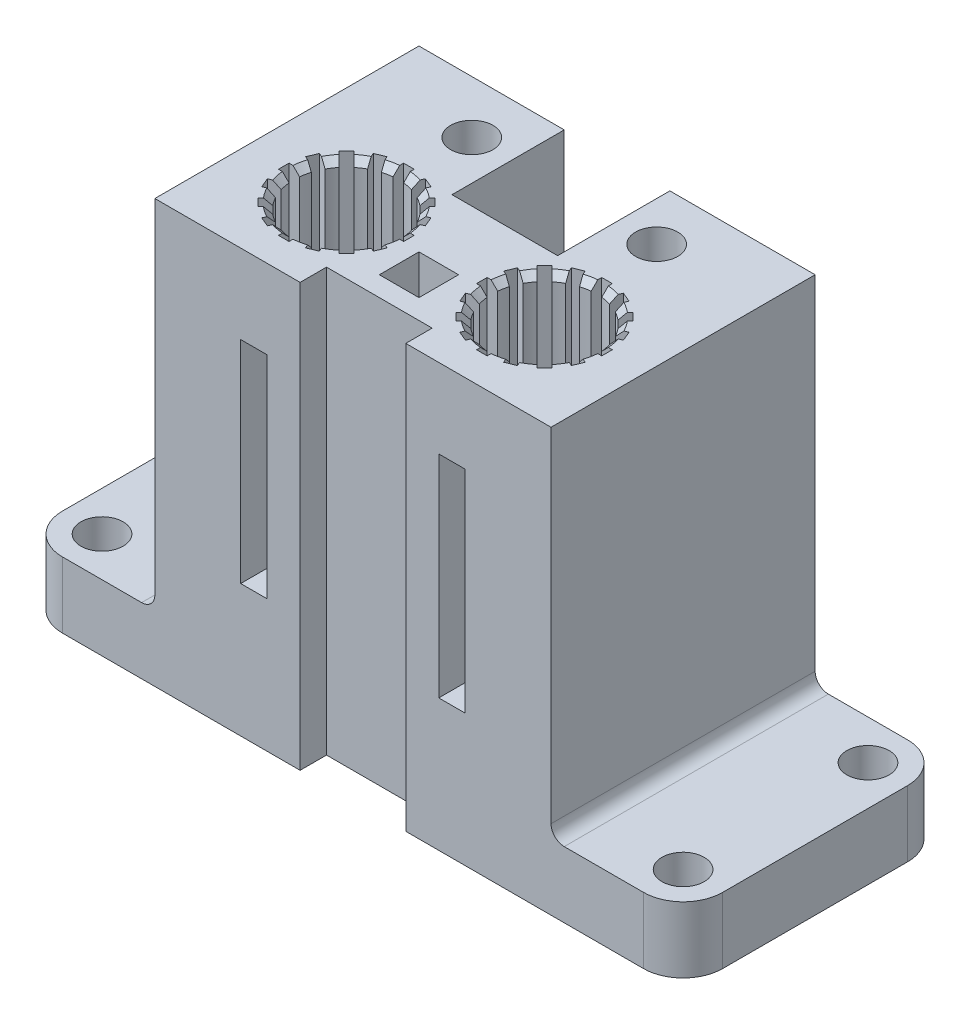
from build123d import *

# Parameters (mm, degrees)
SKETCH_1_W                = 30
SKETCH_1_H                = 20
EXTRUDE_1_DEPTH           = 32
SKETCH_2_R                = 3.96
CUT_EXTRUDE_1_DEPTH       = 8
CUT_EXTRUDE_START         = -12
SKETCH_3_R                = 3.96
CUT_EXTRUDE_2_DEPTH       = 12
SKETCH_4_W                = 8
SKETCH_4_H                = 8.5
CUT_EXTRUDE_3_DEPTH       = 25
SKETCH_6_R                = 2.25
CUT_EXTRUDE_5_DEPTH       = 31.01666204
SKETCH_5_W                = 2
SKETCH_5_H                = 16
CUT_EXTRUDE_4_DEPTH       = 41.607881008
SKETCH_7_W                = 8
SKETCH_7_H                = 2
CUT_EXTRUDE_6_DEPTH       = 37.728735344
SKETCH_8_R                = 1.6
CUT_EXTRUDE_7_DEPTH       = 6
SKETCH_10_R               = 1.6
CUT_EXTRUDE_8_DEPTH       = 6
CHAMFER_1_SIZE            = 0.5
SKETCH_11_W               = 0.8
SKETCH_11_H               = 0.8
CUT_EXTRUDE_9_DEPTH       = 8
PATTERN_CIRCULAR_1_COUNT  = 16
SKETCH_12_W               = 0.8
SKETCH_12_H               = 0.8
CUT_EXTRUDE_10_DEPTH      = 12
PATTERN_CIRCULAR_2_COUNT  = 16
MIRROR_1_COPY_1_SKETCH_W  = 0.8
MIRROR_1_COPY_1_SKETCH_H  = 0.8
MIRROR_1_COPY_1_DEPTH     = 8
MIRROR_1_COPY_2_SKETCH_W  = 0.8
MIRROR_1_COPY_2_SKETCH_H  = 0.8
MIRROR_1_COPY_2_DEPTH     = 8
MIRROR_1_COPY_3_SKETCH_W  = 0.8
MIRROR_1_COPY_3_SKETCH_H  = 0.8
MIRROR_1_COPY_3_DEPTH     = 8
MIRROR_1_COPY_4_SKETCH_W  = 0.8
MIRROR_1_COPY_4_SKETCH_H  = 0.8
MIRROR_1_COPY_4_DEPTH     = 8
MIRROR_1_COPY_5_SKETCH_W  = 0.8
MIRROR_1_COPY_5_SKETCH_H  = 0.8
MIRROR_1_COPY_5_DEPTH     = 8
MIRROR_1_COPY_6_SKETCH_W  = 0.8
MIRROR_1_COPY_6_SKETCH_H  = 0.8
MIRROR_1_COPY_6_DEPTH     = 8
MIRROR_1_COPY_7_SKETCH_W  = 0.8
MIRROR_1_COPY_7_SKETCH_H  = 0.8
MIRROR_1_COPY_7_DEPTH     = 8
MIRROR_1_COPY_8_SKETCH_W  = 0.8
MIRROR_1_COPY_8_SKETCH_H  = 0.8
MIRROR_1_COPY_8_DEPTH     = 8
MIRROR_1_COPY_9_SKETCH_W  = 0.8
MIRROR_1_COPY_9_SKETCH_H  = 0.8
MIRROR_1_COPY_9_DEPTH     = 8
MIRROR_1_COPY_10_SKETCH_W = 0.8
MIRROR_1_COPY_10_SKETCH_H = 0.8
MIRROR_1_COPY_10_DEPTH    = 8
MIRROR_1_COPY_11_SKETCH_W = 0.8
MIRROR_1_COPY_11_SKETCH_H = 0.8
MIRROR_1_COPY_11_DEPTH    = 8
MIRROR_1_COPY_12_SKETCH_W = 0.8
MIRROR_1_COPY_12_SKETCH_H = 0.8
MIRROR_1_COPY_12_DEPTH    = 8
MIRROR_1_COPY_13_SKETCH_W = 0.8
MIRROR_1_COPY_13_SKETCH_H = 0.8
MIRROR_1_COPY_13_DEPTH    = 8
MIRROR_1_COPY_14_SKETCH_W = 0.8
MIRROR_1_COPY_14_SKETCH_H = 0.8
MIRROR_1_COPY_14_DEPTH    = 8
MIRROR_1_COPY_15_SKETCH_W = 0.8
MIRROR_1_COPY_15_SKETCH_H = 0.8
MIRROR_1_COPY_15_DEPTH    = 8
MIRROR_1_COPY_16_SKETCH_W = 0.8
MIRROR_1_COPY_16_SKETCH_H = 0.8
MIRROR_1_COPY_16_DEPTH    = 12
MIRROR_1_COPY_17_SKETCH_W = 0.8
MIRROR_1_COPY_17_SKETCH_H = 0.8
MIRROR_1_COPY_17_DEPTH    = 12
MIRROR_1_COPY_18_SKETCH_W = 0.8
MIRROR_1_COPY_18_SKETCH_H = 0.8
MIRROR_1_COPY_18_DEPTH    = 12
MIRROR_1_COPY_19_SKETCH_W = 0.8
MIRROR_1_COPY_19_SKETCH_H = 0.8
MIRROR_1_COPY_19_DEPTH    = 12
MIRROR_1_COPY_20_SKETCH_W = 0.8
MIRROR_1_COPY_20_SKETCH_H = 0.8
MIRROR_1_COPY_20_DEPTH    = 12
MIRROR_1_COPY_21_SKETCH_W = 0.8
MIRROR_1_COPY_21_SKETCH_H = 0.8
MIRROR_1_COPY_21_DEPTH    = 12
MIRROR_1_COPY_22_SKETCH_W = 0.8
MIRROR_1_COPY_22_SKETCH_H = 0.8
MIRROR_1_COPY_22_DEPTH    = 12
MIRROR_1_COPY_23_SKETCH_W = 0.8
MIRROR_1_COPY_23_SKETCH_H = 0.8
MIRROR_1_COPY_23_DEPTH    = 12
MIRROR_1_COPY_24_SKETCH_W = 0.8
MIRROR_1_COPY_24_SKETCH_H = 0.8
MIRROR_1_COPY_24_DEPTH    = 12
MIRROR_1_COPY_25_SKETCH_W = 0.8
MIRROR_1_COPY_25_SKETCH_H = 0.8
MIRROR_1_COPY_25_DEPTH    = 12
MIRROR_1_COPY_26_SKETCH_W = 0.8
MIRROR_1_COPY_26_SKETCH_H = 0.8
MIRROR_1_COPY_26_DEPTH    = 12
MIRROR_1_COPY_27_SKETCH_W = 0.8
MIRROR_1_COPY_27_SKETCH_H = 0.8
MIRROR_1_COPY_27_DEPTH    = 12
MIRROR_1_COPY_28_SKETCH_W = 0.8
MIRROR_1_COPY_28_SKETCH_H = 0.8
MIRROR_1_COPY_28_DEPTH    = 12
MIRROR_1_COPY_29_SKETCH_W = 0.8
MIRROR_1_COPY_29_SKETCH_H = 0.8
MIRROR_1_COPY_29_DEPTH    = 12
MIRROR_1_COPY_30_SKETCH_W = 0.8
MIRROR_1_COPY_30_SKETCH_H = 0.8
MIRROR_1_COPY_30_DEPTH    = 12
SKETCH_13_W               = 3
SKETCH_13_H               = 3
CUT_EXTRUDE_11_DEPTH      = 4
SKETCH_14_W               = 10
SKETCH_14_H               = 20
EXTRUDE_3_DEPTH           = 5
SKETCH_15_R               = 1.6
CUT_EXTRUDE_12_DEPTH      = 39.13135193
FILLET_1_R                = 1
FILLET_2_R                = 3


with BuildPart() as part:
    # 草图1 → 凸台-拉伸1 (new body)
    with BuildSketch(Plane(origin=(0, 0, 0), x_dir=(1, 0, 0), z_dir=(0, 1, 0))):
        Rectangle(SKETCH_1_W, SKETCH_1_H)
    extrude(amount=EXTRUDE_1_DEPTH)

    # 草图2 → 切除-拉伸1 (cut)
    with BuildSketch(Plane(origin=(0, 32, 0), x_dir=(1, 0, 0), z_dir=(0, 1, 0))):
        with Locations(Location((-7.5, -3, 0), (0, 0, 270))):
            Circle(SKETCH_2_R)
        with Locations(Location((7.5, -3, 0), (0, 0, 270))):
            Circle(SKETCH_2_R)
    extrude(amount=-CUT_EXTRUDE_1_DEPTH, mode=Mode.SUBTRACT)

    # 草图3 → 切除-拉伸2 (cut)
    with BuildSketch(Plane(origin=(0, 24, 0), x_dir=(1, 0, 0), z_dir=(0, 1, 0)).offset(CUT_EXTRUDE_START)):
        with Locations(Location((-7.5, -3, 0), (0, 0, 270))):
            Circle(SKETCH_3_R)
        with Locations(Location((7.5, -3, 0), (0, 0, 270))):
            Circle(SKETCH_3_R)
    extrude(amount=-CUT_EXTRUDE_2_DEPTH, mode=Mode.SUBTRACT)

    # 草图4 → 切除-拉伸3 (cut)
    with BuildSketch(Plane(origin=(0, 32, 0), x_dir=(1, 0, 0), z_dir=(0, 1, 0))):
        with Locations((0, 5.75)):
            Rectangle(SKETCH_4_W, SKETCH_4_H)
    extrude(amount=-CUT_EXTRUDE_3_DEPTH, mode=Mode.SUBTRACT)

    # 草图6 → 切除-拉伸5 (cut, through all)
    with BuildSketch(Plane(origin=(0, 24, 0), x_dir=(1, 0, 0), z_dir=(0, 1, 0))):
        with Locations(Location((7.5, -3, 0), (0, 0, 270))):
            Circle(SKETCH_6_R)
        with Locations(Location((-7.5, -3, 0), (0, 0, 270))):
            Circle(SKETCH_6_R)
    extrude(amount=-CUT_EXTRUDE_5_DEPTH, mode=Mode.SUBTRACT)

    # 草图5 → 切除-拉伸4 (cut, through all)
    with BuildSketch(Plane(origin=(0, 0, -10), x_dir=(-1, 0, 0), z_dir=(0, 0, -1))):
        with Locations((7.5, 18)):
            Rectangle(SKETCH_5_W, SKETCH_5_H)
        with Locations((-7.5, 18)):
            Rectangle(SKETCH_5_W, SKETCH_5_H)
    extrude(amount=-CUT_EXTRUDE_4_DEPTH, mode=Mode.SUBTRACT)

    # 草图7 → 切除-拉伸6 (cut, through all)
    with BuildSketch(Plane(origin=(0, 32, 0), x_dir=(1, 0, 0), z_dir=(0, 1, 0))):
        with Locations((0, -9)):
            Rectangle(SKETCH_7_W, SKETCH_7_H)
    extrude(amount=-CUT_EXTRUDE_6_DEPTH, mode=Mode.SUBTRACT)

    # 草图8 → 切除-拉伸7 (cut)
    with BuildSketch(Plane(origin=(0, 0, -10), x_dir=(-1, 0, 0), z_dir=(0, 0, -1))):
        with Locations((-12, 29)):
            Circle(SKETCH_8_R)
        with Locations(Location((12, 29, 0), (0, 0, 180))):
            Circle(SKETCH_8_R)
        with Locations(Location((-12, 3, 0), (0, 0, 180))):
            Circle(SKETCH_8_R)
        with Locations((12, 3)):
            Circle(SKETCH_8_R)
    extrude(amount=-CUT_EXTRUDE_7_DEPTH, mode=Mode.SUBTRACT)

    # 草图10 → 切除-拉伸8 (cut)
    with BuildSketch(Plane(origin=(0, 32, 0), x_dir=(1, 0, 0), z_dir=(0, 1, 0))):
        with Locations(Location((7, 6, 0), (0, 0, 270))):
            Circle(SKETCH_10_R)
        with Locations(Location((-7, 6, 0), (0, 0, 288.209956864))):
            Circle(SKETCH_10_R)
    extrude(amount=-CUT_EXTRUDE_8_DEPTH, mode=Mode.SUBTRACT)

    # 倒角1
    chamfer_1_edges = [part.edges().sort_by_distance(p)[0] for p in [
        (-7.5, 32, -0.96),
        (7.5, 32, -0.96),
        (-7.5, 0, -0.96),
        (7.5, 0, -0.96),
    ]]
    chamfer(chamfer_1_edges, length=CHAMFER_1_SIZE)

    # 草图11 → 切除-拉伸9 (cut)
    with BuildSketch(Plane(origin=(0, 32, 0), x_dir=(1, 0, 0), z_dir=(0, 1, 0))):
        with Locations((3.160253815, -3)):
            Rectangle(SKETCH_11_W, SKETCH_11_H)
    cut_extrude_9 = extrude(amount=-CUT_EXTRUDE_9_DEPTH, mode=Mode.SUBTRACT)

    # 阵列(圆周)1: 切除-拉伸9 ×16 about axis
    pattern_circular_1_axis = Axis((7.5, 0, 3), (0, 1, 0))
    for i in range(1, PATTERN_CIRCULAR_1_COUNT):
        add(cut_extrude_9.rotate(pattern_circular_1_axis, i * 360 / PATTERN_CIRCULAR_1_COUNT), mode=Mode.SUBTRACT)

    # 草图12 → 切除-拉伸10 (cut)
    with BuildSketch(Plane.XZ):
        with Locations((3.160253815, 3)):
            Rectangle(SKETCH_12_W, SKETCH_12_H)
    cut_extrude_10 = extrude(amount=-CUT_EXTRUDE_10_DEPTH, mode=Mode.SUBTRACT)

    # 阵列(圆周)2: 切除-拉伸10 ×16 about axis
    pattern_circular_2_axis = Axis((7.5, 0, 3), (0, 1, 0))
    for i in range(1, PATTERN_CIRCULAR_2_COUNT):
        add(cut_extrude_10.rotate(pattern_circular_2_axis, i * 360 / PATTERN_CIRCULAR_2_COUNT), mode=Mode.SUBTRACT)

    # 镜向1: 切除-拉伸9, 切除-拉伸10 across plane
    add(cut_extrude_9.mirror(Plane(origin=(0, 0, 0), x_dir=(0, 0, 1), z_dir=(1, 0, 0))), mode=Mode.SUBTRACT)
    add(cut_extrude_10.mirror(Plane(origin=(0, 0, 0), x_dir=(0, 0, 1), z_dir=(1, 0, 0))), mode=Mode.SUBTRACT)

    # 镜向1 copy 1 sketch → 镜向1 copy 1 (cut)
    with BuildSketch(Plane(origin=(0.577146791, 32, 3.098487145), x_dir=(-0.9238795325112867, 0, -0.3826834323650898), z_dir=(0, 1, 0))):
        with Locations((3.160253815, 3)):
            Rectangle(MIRROR_1_COPY_1_SKETCH_W, MIRROR_1_COPY_1_SKETCH_H)
    extrude(amount=-MIRROR_1_COPY_1_DEPTH, mode=Mode.SUBTRACT)

    # 镜向1 copy 2 sketch → 镜向1 copy 2 (cut)
    with BuildSketch(Plane(origin=(-0.075378798, 32, 6.181980515), x_dir=(-0.7071067811865476, 0, -0.7071067811865475), z_dir=(0, 1, 0))):
        with Locations((3.160253815, 3)):
            Rectangle(MIRROR_1_COPY_2_SKETCH_W, MIRROR_1_COPY_2_SKETCH_H)
    extrude(amount=-MIRROR_1_COPY_2_DEPTH, mode=Mode.SUBTRACT)

    # 镜向1 copy 3 sketch → 镜向1 copy 3 (cut)
    with BuildSketch(Plane(origin=(-1.85823566, 32, 8.781046197), x_dir=(-0.38268343236508984, 0, -0.9238795325112867), z_dir=(0, 1, 0))):
        with Locations((3.160253815, 3)):
            Rectangle(MIRROR_1_COPY_3_SKETCH_W, MIRROR_1_COPY_3_SKETCH_H)
    extrude(amount=-MIRROR_1_COPY_3_DEPTH, mode=Mode.SUBTRACT)

    # 镜向1 copy 4 sketch → 镜向1 copy 4 (cut)
    with BuildSketch(Plane(origin=(-4.5, 32, 10.5), x_dir=(0, 0, -1), z_dir=(0, 1, 0))):
        with Locations((3.160253815, 3)):
            Rectangle(MIRROR_1_COPY_4_SKETCH_W, MIRROR_1_COPY_4_SKETCH_H)
    extrude(amount=-MIRROR_1_COPY_4_DEPTH, mode=Mode.SUBTRACT)

    # 镜向1 copy 5 sketch → 镜向1 copy 5 (cut)
    with BuildSketch(Plane(origin=(-7.598487145, 32, 11.077146791), x_dir=(0.3826834323650897, 0, -0.9238795325112867), z_dir=(0, 1, 0))):
        with Locations((3.160253815, 3)):
            Rectangle(MIRROR_1_COPY_5_SKETCH_W, MIRROR_1_COPY_5_SKETCH_H)
    extrude(amount=-MIRROR_1_COPY_5_DEPTH, mode=Mode.SUBTRACT)

    # 镜向1 copy 6 sketch → 镜向1 copy 6 (cut)
    with BuildSketch(Plane(origin=(-10.681980515, 32, 10.424621202), x_dir=(0.7071067811865475, 0, -0.7071067811865476), z_dir=(0, 1, 0))):
        with Locations((3.160253815, 3)):
            Rectangle(MIRROR_1_COPY_6_SKETCH_W, MIRROR_1_COPY_6_SKETCH_H)
    extrude(amount=-MIRROR_1_COPY_6_DEPTH, mode=Mode.SUBTRACT)

    # 镜向1 copy 7 sketch → 镜向1 copy 7 (cut)
    with BuildSketch(Plane(origin=(-13.281046197, 32, 8.64176434), x_dir=(0.9238795325112867, 0, -0.3826834323650899), z_dir=(0, 1, 0))):
        with Locations((3.160253815, 3)):
            Rectangle(MIRROR_1_COPY_7_SKETCH_W, MIRROR_1_COPY_7_SKETCH_H)
    extrude(amount=-MIRROR_1_COPY_7_DEPTH, mode=Mode.SUBTRACT)

    # 镜向1 copy 8 sketch → 镜向1 copy 8 (cut)
    with BuildSketch(Plane(origin=(-15, 32, 6), x_dir=(1, 0, 0), z_dir=(0, 1, 0))):
        with Locations((3.160253815, 3)):
            Rectangle(MIRROR_1_COPY_8_SKETCH_W, MIRROR_1_COPY_8_SKETCH_H)
    extrude(amount=-MIRROR_1_COPY_8_DEPTH, mode=Mode.SUBTRACT)

    # 镜向1 copy 9 sketch → 镜向1 copy 9 (cut)
    with BuildSketch(Plane(origin=(-15.577146791, 32, 2.901512855), x_dir=(0.9238795325112868, 0, 0.38268343236508967), z_dir=(0, 1, 0))):
        with Locations((3.160253815, 3)):
            Rectangle(MIRROR_1_COPY_9_SKETCH_W, MIRROR_1_COPY_9_SKETCH_H)
    extrude(amount=-MIRROR_1_COPY_9_DEPTH, mode=Mode.SUBTRACT)

    # 镜向1 copy 10 sketch → 镜向1 copy 10 (cut)
    with BuildSketch(Plane(origin=(-14.924621202, 32, -0.181980515), x_dir=(0.7071067811865477, 0, 0.7071067811865475), z_dir=(0, 1, 0))):
        with Locations((3.160253815, 3)):
            Rectangle(MIRROR_1_COPY_10_SKETCH_W, MIRROR_1_COPY_10_SKETCH_H)
    extrude(amount=-MIRROR_1_COPY_10_DEPTH, mode=Mode.SUBTRACT)

    # 镜向1 copy 11 sketch → 镜向1 copy 11 (cut)
    with BuildSketch(Plane(origin=(-13.14176434, 32, -2.781046197), x_dir=(0.3826834323650895, 0, 0.9238795325112868), z_dir=(0, 1, 0))):
        with Locations((3.160253815, 3)):
            Rectangle(MIRROR_1_COPY_11_SKETCH_W, MIRROR_1_COPY_11_SKETCH_H)
    extrude(amount=-MIRROR_1_COPY_11_DEPTH, mode=Mode.SUBTRACT)

    # 镜向1 copy 12 sketch → 镜向1 copy 12 (cut)
    with BuildSketch(Plane(origin=(-10.5, 32, -4.5), x_dir=(0, 0, 1), z_dir=(0, 1, 0))):
        with Locations((3.160253815, 3)):
            Rectangle(MIRROR_1_COPY_12_SKETCH_W, MIRROR_1_COPY_12_SKETCH_H)
    extrude(amount=-MIRROR_1_COPY_12_DEPTH, mode=Mode.SUBTRACT)

    # 镜向1 copy 13 sketch → 镜向1 copy 13 (cut)
    with BuildSketch(Plane(origin=(-7.401512855, 32, -5.077146791), x_dir=(-0.38268343236509, 0, 0.9238795325112866), z_dir=(0, 1, 0))):
        with Locations((3.160253815, 3)):
            Rectangle(MIRROR_1_COPY_13_SKETCH_W, MIRROR_1_COPY_13_SKETCH_H)
    extrude(amount=-MIRROR_1_COPY_13_DEPTH, mode=Mode.SUBTRACT)

    # 镜向1 copy 14 sketch → 镜向1 copy 14 (cut)
    with BuildSketch(Plane(origin=(-4.318019485, 32, -4.424621202), x_dir=(-0.7071067811865474, 0, 0.7071067811865477), z_dir=(0, 1, 0))):
        with Locations((3.160253815, 3)):
            Rectangle(MIRROR_1_COPY_14_SKETCH_W, MIRROR_1_COPY_14_SKETCH_H)
    extrude(amount=-MIRROR_1_COPY_14_DEPTH, mode=Mode.SUBTRACT)

    # 镜向1 copy 15 sketch → 镜向1 copy 15 (cut)
    with BuildSketch(Plane(origin=(-1.718953803, 32, -2.64176434), x_dir=(-0.9238795325112868, 0, 0.38268343236508956), z_dir=(0, 1, 0))):
        with Locations((3.160253815, 3)):
            Rectangle(MIRROR_1_COPY_15_SKETCH_W, MIRROR_1_COPY_15_SKETCH_H)
    extrude(amount=-MIRROR_1_COPY_15_DEPTH, mode=Mode.SUBTRACT)

    # 镜向1 copy 16 sketch → 镜向1 copy 16 (cut)
    with BuildSketch(Plane(origin=(0.577146791, 0, 3.098487145), x_dir=(-0.9238795325112867, 0, -0.3826834323650898), z_dir=(0, -1, 0))):
        with Locations((3.160253815, -3)):
            Rectangle(MIRROR_1_COPY_16_SKETCH_W, MIRROR_1_COPY_16_SKETCH_H)
    extrude(amount=-MIRROR_1_COPY_16_DEPTH, mode=Mode.SUBTRACT)

    # 镜向1 copy 17 sketch → 镜向1 copy 17 (cut)
    with BuildSketch(Plane(origin=(-0.075378798, 0, 6.181980515), x_dir=(-0.7071067811865476, 0, -0.7071067811865475), z_dir=(0, -1, 0))):
        with Locations((3.160253815, -3)):
            Rectangle(MIRROR_1_COPY_17_SKETCH_W, MIRROR_1_COPY_17_SKETCH_H)
    extrude(amount=-MIRROR_1_COPY_17_DEPTH, mode=Mode.SUBTRACT)

    # 镜向1 copy 18 sketch → 镜向1 copy 18 (cut)
    with BuildSketch(Plane(origin=(-1.85823566, 0, 8.781046197), x_dir=(-0.38268343236508984, 0, -0.9238795325112867), z_dir=(0, -1, 0))):
        with Locations((3.160253815, -3)):
            Rectangle(MIRROR_1_COPY_18_SKETCH_W, MIRROR_1_COPY_18_SKETCH_H)
    extrude(amount=-MIRROR_1_COPY_18_DEPTH, mode=Mode.SUBTRACT)

    # 镜向1 copy 19 sketch → 镜向1 copy 19 (cut)
    with BuildSketch(Plane(origin=(-4.5, 0, 10.5), x_dir=(0, 0, -1), z_dir=(0, -1, 0))):
        with Locations((3.160253815, -3)):
            Rectangle(MIRROR_1_COPY_19_SKETCH_W, MIRROR_1_COPY_19_SKETCH_H)
    extrude(amount=-MIRROR_1_COPY_19_DEPTH, mode=Mode.SUBTRACT)

    # 镜向1 copy 20 sketch → 镜向1 copy 20 (cut)
    with BuildSketch(Plane(origin=(-7.598487145, 0, 11.077146791), x_dir=(0.3826834323650897, 0, -0.9238795325112867), z_dir=(0, -1, 0))):
        with Locations((3.160253815, -3)):
            Rectangle(MIRROR_1_COPY_20_SKETCH_W, MIRROR_1_COPY_20_SKETCH_H)
    extrude(amount=-MIRROR_1_COPY_20_DEPTH, mode=Mode.SUBTRACT)

    # 镜向1 copy 21 sketch → 镜向1 copy 21 (cut)
    with BuildSketch(Plane(origin=(-10.681980515, 0, 10.424621202), x_dir=(0.7071067811865475, 0, -0.7071067811865476), z_dir=(0, -1, 0))):
        with Locations((3.160253815, -3)):
            Rectangle(MIRROR_1_COPY_21_SKETCH_W, MIRROR_1_COPY_21_SKETCH_H)
    extrude(amount=-MIRROR_1_COPY_21_DEPTH, mode=Mode.SUBTRACT)

    # 镜向1 copy 22 sketch → 镜向1 copy 22 (cut)
    with BuildSketch(Plane(origin=(-13.281046197, 0, 8.64176434), x_dir=(0.9238795325112867, 0, -0.3826834323650899), z_dir=(0, -1, 0))):
        with Locations((3.160253815, -3)):
            Rectangle(MIRROR_1_COPY_22_SKETCH_W, MIRROR_1_COPY_22_SKETCH_H)
    extrude(amount=-MIRROR_1_COPY_22_DEPTH, mode=Mode.SUBTRACT)

    # 镜向1 copy 23 sketch → 镜向1 copy 23 (cut)
    with BuildSketch(Plane(origin=(-15, 0, 6), x_dir=(1, 0, 0), z_dir=(0, -1, 0))):
        with Locations((3.160253815, -3)):
            Rectangle(MIRROR_1_COPY_23_SKETCH_W, MIRROR_1_COPY_23_SKETCH_H)
    extrude(amount=-MIRROR_1_COPY_23_DEPTH, mode=Mode.SUBTRACT)

    # 镜向1 copy 24 sketch → 镜向1 copy 24 (cut)
    with BuildSketch(Plane(origin=(-15.577146791, 0, 2.901512855), x_dir=(0.9238795325112868, 0, 0.38268343236508967), z_dir=(0, -1, 0))):
        with Locations((3.160253815, -3)):
            Rectangle(MIRROR_1_COPY_24_SKETCH_W, MIRROR_1_COPY_24_SKETCH_H)
    extrude(amount=-MIRROR_1_COPY_24_DEPTH, mode=Mode.SUBTRACT)

    # 镜向1 copy 25 sketch → 镜向1 copy 25 (cut)
    with BuildSketch(Plane(origin=(-14.924621202, 0, -0.181980515), x_dir=(0.7071067811865477, 0, 0.7071067811865475), z_dir=(0, -1, 0))):
        with Locations((3.160253815, -3)):
            Rectangle(MIRROR_1_COPY_25_SKETCH_W, MIRROR_1_COPY_25_SKETCH_H)
    extrude(amount=-MIRROR_1_COPY_25_DEPTH, mode=Mode.SUBTRACT)

    # 镜向1 copy 26 sketch → 镜向1 copy 26 (cut)
    with BuildSketch(Plane(origin=(-13.14176434, 0, -2.781046197), x_dir=(0.3826834323650895, 0, 0.9238795325112868), z_dir=(0, -1, 0))):
        with Locations((3.160253815, -3)):
            Rectangle(MIRROR_1_COPY_26_SKETCH_W, MIRROR_1_COPY_26_SKETCH_H)
    extrude(amount=-MIRROR_1_COPY_26_DEPTH, mode=Mode.SUBTRACT)

    # 镜向1 copy 27 sketch → 镜向1 copy 27 (cut)
    with BuildSketch(Plane(origin=(-10.5, 0, -4.5), x_dir=(0, 0, 1), z_dir=(0, -1, 0))):
        with Locations((3.160253815, -3)):
            Rectangle(MIRROR_1_COPY_27_SKETCH_W, MIRROR_1_COPY_27_SKETCH_H)
    extrude(amount=-MIRROR_1_COPY_27_DEPTH, mode=Mode.SUBTRACT)

    # 镜向1 copy 28 sketch → 镜向1 copy 28 (cut)
    with BuildSketch(Plane(origin=(-7.401512855, 0, -5.077146791), x_dir=(-0.38268343236509, 0, 0.9238795325112866), z_dir=(0, -1, 0))):
        with Locations((3.160253815, -3)):
            Rectangle(MIRROR_1_COPY_28_SKETCH_W, MIRROR_1_COPY_28_SKETCH_H)
    extrude(amount=-MIRROR_1_COPY_28_DEPTH, mode=Mode.SUBTRACT)

    # 镜向1 copy 29 sketch → 镜向1 copy 29 (cut)
    with BuildSketch(Plane(origin=(-4.318019485, 0, -4.424621202), x_dir=(-0.7071067811865474, 0, 0.7071067811865477), z_dir=(0, -1, 0))):
        with Locations((3.160253815, -3)):
            Rectangle(MIRROR_1_COPY_29_SKETCH_W, MIRROR_1_COPY_29_SKETCH_H)
    extrude(amount=-MIRROR_1_COPY_29_DEPTH, mode=Mode.SUBTRACT)

    # 镜向1 copy 30 sketch → 镜向1 copy 30 (cut)
    with BuildSketch(Plane(origin=(-1.718953803, 0, -2.64176434), x_dir=(-0.9238795325112868, 0, 0.38268343236508956), z_dir=(0, -1, 0))):
        with Locations((3.160253815, -3)):
            Rectangle(MIRROR_1_COPY_30_SKETCH_W, MIRROR_1_COPY_30_SKETCH_H)
    extrude(amount=-MIRROR_1_COPY_30_DEPTH, mode=Mode.SUBTRACT)

    # 草图13 → 切除-拉伸11 (cut)
    with BuildSketch(Plane(origin=(0, 32, 0), x_dir=(1, 0, 0), z_dir=(0, 1, 0))):
        with Locations((0, -5)):
            Rectangle(SKETCH_13_W, SKETCH_13_H)
    extrude(amount=-CUT_EXTRUDE_11_DEPTH, mode=Mode.SUBTRACT)

    # 草图14 → 凸台-拉伸3 (add)
    with BuildSketch(Plane.XZ):
        with Locations((20, 0)):
            Rectangle(SKETCH_14_W, SKETCH_14_H)
    extrude_3 = extrude(amount=-EXTRUDE_3_DEPTH)

    # 草图15 → 切除-拉伸12 (cut, through all)
    with BuildSketch(Plane(origin=(0, 5, 0), x_dir=(1, 0, 0), z_dir=(0, 1, 0))):
        with Locations(Location((22, 7, 0), (0, 0, 270))):
            Circle(SKETCH_15_R)
        with Locations(Location((22, -7, 0), (0, 0, 90))):
            Circle(SKETCH_15_R)
    cut_extrude_12 = extrude(amount=-CUT_EXTRUDE_12_DEPTH, mode=Mode.SUBTRACT)

    # 镜向6: 凸台-拉伸3, 切除-拉伸12 across plane
    add(extrude_3.mirror(Plane(origin=(0, 0, 0), x_dir=(0, 0, 1), z_dir=(1, 0, 0))))
    add(cut_extrude_12.mirror(Plane(origin=(0, 0, 0), x_dir=(0, 0, 1), z_dir=(1, 0, 0))), mode=Mode.SUBTRACT)

    # 圆角1
    fillet_1_edges = [part.edges().sort_by_distance(p)[0] for p in [
        (15, 5, 0),
        (-15, 5, 0),
    ]]
    fillet(fillet_1_edges, radius=FILLET_1_R)

    # 圆角2
    fillet_2_edges = [part.edges().sort_by_distance(p)[0] for p in [
        (25, 2.5, 10),
        (25, 2.5, -10),
        (-25, 2.5, -10),
        (-25, 2.5, 10),
    ]]
    fillet(fillet_2_edges, radius=FILLET_2_R)


solid = part.part
